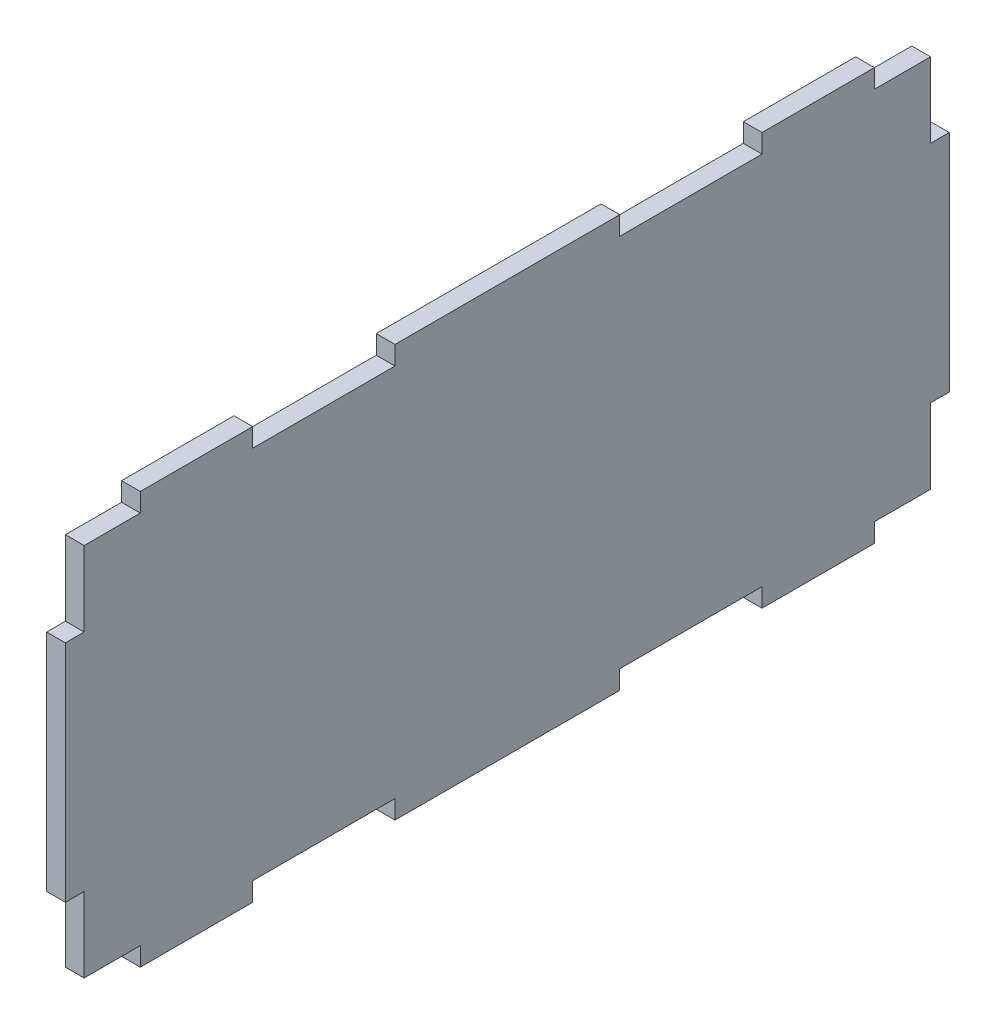
from build123d import *

# Parameters (mm, degrees)
BOSS_EXTRUDE1_DEPTH = 5


with BuildPart() as part:
    # Sketch1 → Boss-Extrude1 (new body)
    with BuildSketch(Plane(origin=(0, 0, 0), x_dir=(0, 0, -1), z_dir=(1, 0, 0))):
        Polygon((98, -50), (113, -50), (113, -30), (118, -30), (118, 30), (113, 30), (113, 50), (98, 50), (98, 55), (68, 55), (68, 50), (30, 50), (30, 55), (-30, 55), (-30, 50), (-68, 50), (-68, 55), (-98, 55), (-98, 50), (-113, 50), (-113, 30), (-118, 30), (-118, -30), (-113, -30), (-113, -50), (-98, -50), (-98, -55), (-68, -55), (-68, -50), (-30, -50), (-30, -55), (30, -55), (30, -50), (68, -50), (68, -55), (98, -55), align=None)
    extrude(amount=BOSS_EXTRUDE1_DEPTH)


solid = part.part
